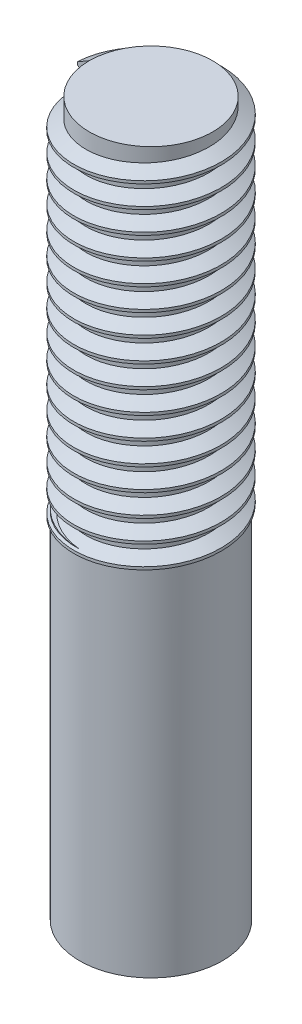
from build123d import *
from build123d.topology import SkipClean

# Parameters (mm, degrees)
CUT_EXTRUDE3_START = -20
SKETCH13_R         = 4
SKETCH13_R_2       = 3.46
CUT_EXTRUDE3_DEPTH = 20
THREAD2_PITCH      = 1.25


with BuildPart() as part:
    # Sketch3 → Revolve1 (revolve)
    with BuildSketch(Plane.XY, mode=Mode.PRIVATE) as revolve1_sk:
        Polygon((2.5, 0), (2.5, 16), (0, 17.443375673), (0, 40), (4, 40), (4, 0), align=None)
    revolve(revolve1_sk.sketch.rotate(Axis((0, 0, 0), (0, 1, 0)), 90), axis=Axis((0, 0, 0), (0, 1, 0)))

    # Sketch13 → Cut-Extrude3 (cut)
    with BuildSketch(Plane(origin=(0, 40, 0), x_dir=(1, 0, 0), z_dir=(0, 1, 0)).offset(CUT_EXTRUDE3_START)):
        with Locations(Location((0, 0, 0), (0, 0, 90))):
            Circle(SKETCH13_R)
        with Locations(Location((0, 0, 0), (0, 0, 270))):
            Circle(SKETCH13_R_2, mode=Mode.SUBTRACT)
    extrude(amount=CUT_EXTRUDE3_DEPTH, mode=Mode.SUBTRACT)

    # Thread2: the profile of Thread Profile6 profile screwed along a right-hand helix of 16 turns, 8 arcs to a turn; built about Z, then put on its axis
    with SkipClean():  # the faces are left unmerged after this step: merging them gives an invalid solid
        thread2_z = Axis((0, 0, 0), (0, 0, 1))
        thread2_corners = [(3.4597, 0, -0.000173205), (4.136582344, 0, 0.390624998), (4.136582344, 0, 0.546874998), (3.4597, 0, 0.937673202)]
        with BuildLine(mode=Mode.PRIVATE) as thread2_profile:
            Line(thread2_corners[0], thread2_corners[1])
            Line(thread2_corners[1], thread2_corners[2])
            Line(thread2_corners[2], thread2_corners[3])
            Line(thread2_corners[3], thread2_corners[0])
        thread2_cap = Face(thread2_profile.wire())
        thread2_turn_angles = [0, 22.5, 45, 67.5, 90, 112.5, 135, 157.5, 180, 202.5, 225, 247.5, 270, 292.5, 315, 337.5, 360]
        thread2_turn_weights = [1, 0.9238795325112867, 1, 0.9238795325112867, 1, 0.9238795325112867, 1, 0.9238795325112867, 1, 0.9238795325112867, 1, 0.9238795325112867, 1, 0.9238795325112867, 1, 0.9238795325112867, 1]
        thread2_turn_rails = [Edge.make_bspline([Vector(p[0], p[1], 0).rotate(thread2_z, thread2_turn_angles[k]) / thread2_turn_weights[k] + Vector(0, 0, p[2] + THREAD2_PITCH * thread2_turn_angles[k] / 360) for k in range(17)], [0, 0, 0, 1, 1, 2, 2, 3, 3, 4, 4, 5, 5, 6, 6, 7, 7, 8, 8, 8], 2, thread2_turn_weights) for p in thread2_corners]
        thread2_turn_sides = [Face.make_surface_from_curves(thread2_turn_rails[p[0]], thread2_turn_rails[p[1]]) for p in [(0, 1), (1, 2), (2, 3), (3, 0)]]
        thread2 = Plane(origin=(0, 40, 0), x_dir=(-1, 0, 0), z_dir=(0, -1, 0)) * Solid(Shell([*[p.moved(Location((0, 0, THREAD2_PITCH * i))) for i in range(16) for p in thread2_turn_sides], thread2_cap, thread2_cap.rotate(thread2_z, 5760).moved(Location((0, 0, THREAD2_PITCH * 5760 / 360)))]))
        add(thread2)


solid = part.part
